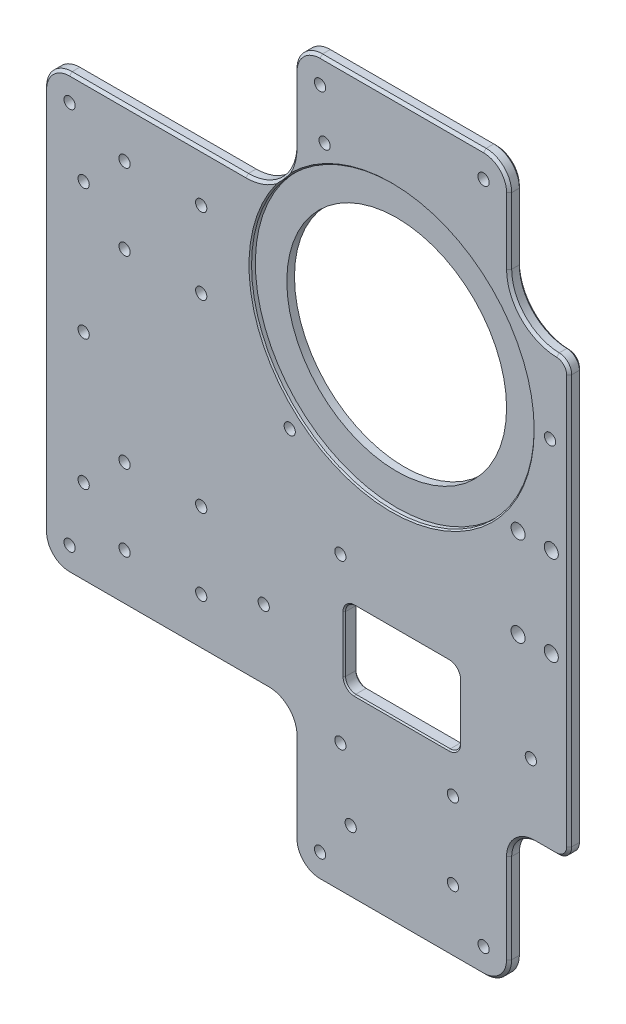
from build123d import *

# Parameters (mm, degrees)
SKETCH_1_R               = 2.2
EXTRUDE_1_DEPTH          = 5
FILLET_1_R               = 10
CUT_EXTRUDE_1_REACH      = 322.455
SKETCH_2_R               = 2.2
CUT_EXTRUDE_2_REACH      = 322.455
SKETCH_3_R               = 43
CUT_EXTRUDE_START        = 88.5
SKETCH_4_R               = 55.3
CUT_EXTRUDE_3_DEPTH      = 2
FILLET_2_R               = 19
CHAMFER_2_SIZE           = 0.5
CUT_EXTRUDE_4_DEPTH      = 5
CUT_EXTRUDE_5_DEPTH      = 5
FILLET_6_R               = 5
CHAMFER_6_SIZE           = 1
HOLE_WIZARD_4_4_4_4_1_D  = 4.4
HOLE_WIZARD_4_4_4_4_2_D  = 4.4
CUT_EXTRUDE_6_DEPTH      = 271.652805956
CUT_EXTRUDE_6_DEPTH_BACK = 271.652805956
CHAMFER_7_SIZE           = 0.5


with BuildPart() as part:
    # 草图1 → 凸台-拉伸1 (new body)
    with BuildSketch(Plane.XY):
        Polygon((-45.175512351, 7), (-45.175512351, -163), (52.824487649, -163), (52.824487649, -218), (136.824487649, -218), (136.824487649, -163), (234.824487649, -163), (234.824487649, 7), (136.824487649, 7), (136.824487649, 62), (52.824487649, 62), (52.824487649, 7), align=None)
        with Locations((-13.675512351, -143.9)):
            Circle(SKETCH_1_R, mode=Mode.SUBTRACT)
        with Locations((-13.675512351, -114.1)):
            Circle(SKETCH_1_R, mode=Mode.SUBTRACT)
        with Locations((16.324487649, -143.9)):
            Circle(SKETCH_1_R, mode=Mode.SUBTRACT)
        with Locations((16.324487649, -114.1)):
            Circle(SKETCH_1_R, mode=Mode.SUBTRACT)
        with Locations((173.324487649, -143.9)):
            Circle(SKETCH_1_R, mode=Mode.SUBTRACT)
        with Locations((173.324487649, -114.1)):
            Circle(SKETCH_1_R, mode=Mode.SUBTRACT)
        with Locations((203.324487649, -143.9)):
            Circle(SKETCH_1_R, mode=Mode.SUBTRACT)
        with Locations((203.324487649, -114.1)):
            Circle(SKETCH_1_R, mode=Mode.SUBTRACT)
        with Locations((-13.675512351, -41.9)):
            Circle(SKETCH_1_R, mode=Mode.SUBTRACT)
        with Locations((-13.675512351, -12.1)):
            Circle(SKETCH_1_R, mode=Mode.SUBTRACT)
        with Locations((16.324487649, -41.9)):
            Circle(SKETCH_1_R, mode=Mode.SUBTRACT)
        with Locations((16.324487649, -12.1)):
            Circle(SKETCH_1_R, mode=Mode.SUBTRACT)
        with Locations((173.324487649, -41.9)):
            Circle(SKETCH_1_R, mode=Mode.SUBTRACT)
        with Locations((173.324487649, -12.1)):
            Circle(SKETCH_1_R, mode=Mode.SUBTRACT)
        with Locations((203.324487649, -41.9)):
            Circle(SKETCH_1_R, mode=Mode.SUBTRACT)
        with Locations((203.324487649, -12.1)):
            Circle(SKETCH_1_R, mode=Mode.SUBTRACT)
    extrude(amount=EXTRUDE_1_DEPTH)

    # 圆角1
    fillet_1_edges = [part.edges().sort_by_distance(p)[0] for p in [
        (234.824487649, 7, 2.5),
        (234.824487649, -163, 2.5),
        (136.824487649, -163, 2.5),
        (136.824487649, -218, 2.5),
        (52.824487649, -218, 2.5),
        (52.824487649, -163, 2.5),
        (-45.175512351, -163, 2.5),
        (-45.175512351, 7, 2.5),
        (52.824487649, 62, 2.5),
        (136.824487649, 62, 2.5),
    ]]
    fillet(fillet_1_edges, radius=FILLET_1_R)

    # 草图2 → 切除-拉伸1 (cut, up to next)
    with BuildSketch(Plane(origin=(0, 0, 0), x_dir=(-1, 0, 0), z_dir=(0, 0, -1)), mode=Mode.PRIVATE) as cut_extrude_1_sk1:
        with Locations(Location((-70.783467987, -103.063390978, 0), (0, 0, 90))):
            Circle(SKETCH_2_R)
    cut_extrude_1_tool1 = extrude(cut_extrude_1_sk1.sketch, amount=-CUT_EXTRUDE_1_REACH, mode=Mode.PRIVATE) & part.part
    # 草图2 → 切除-拉伸1 (cut, up to next)
    with BuildSketch(Plane(origin=(0, 0, 0), x_dir=(-1, 0, 0), z_dir=(0, 0, -1)), mode=Mode.PRIVATE) as cut_extrude_1_sk2:
        with Locations(Location((-40.783467987, -135.063390978, 0), (0, 0, 90))):
            Circle(SKETCH_2_R)
    cut_extrude_1_tool2 = extrude(cut_extrude_1_sk2.sketch, amount=-CUT_EXTRUDE_1_REACH, mode=Mode.PRIVATE) & part.part
    # 草图2 → 切除-拉伸1 (cut, up to next)
    with BuildSketch(Plane(origin=(0, 0, 0), x_dir=(-1, 0, 0), z_dir=(0, 0, -1)), mode=Mode.PRIVATE) as cut_extrude_1_sk3:
        with Locations(Location((-70.783467987, -167.063390978, 0), (0, 0, 90))):
            Circle(SKETCH_2_R)
    cut_extrude_1_tool3 = extrude(cut_extrude_1_sk3.sketch, amount=-CUT_EXTRUDE_1_REACH, mode=Mode.PRIVATE) & part.part
    add(cut_extrude_1_tool1.solids().sort_by_distance((70.783468, -103.063391, 0))[0], mode=Mode.SUBTRACT)
    add(cut_extrude_1_tool2.solids().sort_by_distance((40.783468, -135.063391, 0))[0], mode=Mode.SUBTRACT)
    add(cut_extrude_1_tool3.solids().sort_by_distance((70.783468, -167.063391, 0))[0], mode=Mode.SUBTRACT)

    # 草图3 → 切除-拉伸2 (cut, up to next)
    with BuildSketch(Plane.XY.offset(5), mode=Mode.PRIVATE) as cut_extrude_2_sk1:
        with Locations((90.824487649, -23)):
            Circle(SKETCH_3_R)
    cut_extrude_2_tool1 = extrude(cut_extrude_2_sk1.sketch, amount=-CUT_EXTRUDE_2_REACH, mode=Mode.PRIVATE) & part.part
    add(cut_extrude_2_tool1.solids().sort_by_distance((90.824488, -23, 5))[0], mode=Mode.SUBTRACT)

    # 草图4 → 切除-拉伸3 (cut)
    with BuildSketch(Plane(origin=(94.824487649, -78, -83.5), x_dir=(0, -1, 0), z_dir=(0, 0, 1)).offset(CUT_EXTRUDE_START)):
        with Locations((-55, -4)):
            Circle(SKETCH_4_R)
    extrude(amount=-CUT_EXTRUDE_3_DEPTH, mode=Mode.SUBTRACT)

    # 圆角2
    # the kernel refuses this fillet: 19 mm, written as the material it adds along each edge
    with BuildSketch(Plane(origin=(52.824487649, 7, 0), x_dir=(-1, 0, 0), z_dir=(0, 0, 1))) as fillet_2_piece_1_section:
        with BuildLine():
            CenterArc((FILLET_2_R, -FILLET_2_R), FILLET_2_R, 90, 90)
            Line((0, -FILLET_2_R), (0, 0))
            Line((0, 0), (FILLET_2_R, 0))
        make_face()
    fillet_2_piece_1 = extrude(amount=3, mode=Mode.PRIVATE)
    fillet_2_piece_1 = fillet_2_piece_1 - Plane(origin=(90.824487649, -23, 0), x_dir=(0, -1, 0), z_dir=(0, 0, 1)) * Cylinder(55.3, 82, mode=Mode.PRIVATE)
    add(fillet_2_piece_1)
    with BuildSketch(Plane(origin=(52.824487649, 7, 0), x_dir=(-1, 0, 0), z_dir=(0, 0, 1))) as fillet_2_piece_2_section:
        with BuildLine():
            CenterArc((FILLET_2_R, -FILLET_2_R), FILLET_2_R, 90, 90)
            Line((0, -FILLET_2_R), (0, 0))
            Line((0, 0), (FILLET_2_R, 0))
        make_face()
    fillet_2_piece_2 = extrude(amount=50.5, mode=Mode.PRIVATE)
    fillet_2_piece_2 = split(fillet_2_piece_2, bisect_by=Plane(origin=(52.824487649, 7, 5), z_dir=(0, 0, -1)), keep=Keep.TOP, mode=Mode.PRIVATE)
    fillet_2_piece_2 = fillet_2_piece_2 - Plane(origin=(90.824487649, -23, 0), x_dir=(0, -1, 0), z_dir=(0, 0, 1)) * Cylinder(55.3, 177, mode=Mode.PRIVATE)
    fillet_2_piece_2 = split(fillet_2_piece_2, bisect_by=Plane(origin=(52.824487649, 7, 3), z_dir=(0, 0, 1)), keep=Keep.TOP, mode=Mode.PRIVATE)
    add(fillet_2_piece_2)
    with BuildSketch(Plane(origin=(52.824487649, 7, 0), x_dir=(-1, 0, 0), z_dir=(0, 0, 1))) as fillet_2_piece_3_section:
        with BuildLine():
            CenterArc((FILLET_2_R, -FILLET_2_R), FILLET_2_R, 90, 90)
            Line((0, -FILLET_2_R), (0, 0))
            Line((0, 0), (FILLET_2_R, 0))
        make_face()
    fillet_2_piece_3 = extrude(amount=3, mode=Mode.PRIVATE)
    fillet_2_piece_3 = fillet_2_piece_3 & Plane(origin=(90.824487649, -23, 0), x_dir=(0, -1, 0), z_dir=(0, 0, 1)) * Cylinder(55.3, 82, mode=Mode.PRIVATE)
    add(fillet_2_piece_3)
    with BuildSketch(Plane(origin=(136.824487649, 7, 0), x_dir=(1, 0, 0), z_dir=(0, 0, 1))) as fillet_2_piece_4_section:
        with BuildLine():
            CenterArc((FILLET_2_R, FILLET_2_R), FILLET_2_R, 180, 90)
            Line((0, FILLET_2_R), (0, 0))
            Line((0, 0), (FILLET_2_R, 0))
        make_face()
    fillet_2_piece_4 = extrude(amount=3, mode=Mode.PRIVATE)
    fillet_2_piece_4 = fillet_2_piece_4 - Plane(origin=(90.824487649, -23, 0), x_dir=(0, -1, 0), z_dir=(0, 0, 1)) * Cylinder(55.3, 82, mode=Mode.PRIVATE)
    add(fillet_2_piece_4)
    with BuildSketch(Plane(origin=(136.824487649, 7, 0), x_dir=(1, 0, 0), z_dir=(0, 0, 1))) as fillet_2_piece_5_section:
        with BuildLine():
            CenterArc((FILLET_2_R, FILLET_2_R), FILLET_2_R, 180, 90)
            Line((0, FILLET_2_R), (0, 0))
            Line((0, 0), (FILLET_2_R, 0))
        make_face()
    fillet_2_piece_5 = extrude(amount=50.5, mode=Mode.PRIVATE)
    fillet_2_piece_5 = split(fillet_2_piece_5, bisect_by=Plane(origin=(136.824487649, 7, 3), z_dir=(0, 0, 1)), keep=Keep.TOP, mode=Mode.PRIVATE)
    fillet_2_piece_5 = fillet_2_piece_5 - Plane(origin=(90.824487649, -23, 0), x_dir=(0, -1, 0), z_dir=(0, 0, 1)) * Cylinder(55.3, 177, mode=Mode.PRIVATE)
    fillet_2_piece_5 = split(fillet_2_piece_5, bisect_by=Plane(origin=(136.824487649, 7, 5), z_dir=(0, 0, -1)), keep=Keep.TOP, mode=Mode.PRIVATE)
    add(fillet_2_piece_5)
    with BuildSketch(Plane(origin=(136.824487649, 7, 0), x_dir=(1, 0, 0), z_dir=(0, 0, 1))) as fillet_2_piece_6_section:
        with BuildLine():
            CenterArc((FILLET_2_R, FILLET_2_R), FILLET_2_R, 180, 90)
            Line((0, FILLET_2_R), (0, 0))
            Line((0, 0), (FILLET_2_R, 0))
        make_face()
    fillet_2_piece_6 = extrude(amount=3, mode=Mode.PRIVATE)
    fillet_2_piece_6 = fillet_2_piece_6 & Plane(origin=(90.824487649, -23, 0), x_dir=(0, -1, 0), z_dir=(0, 0, 1)) * Cylinder(55.3, 82, mode=Mode.PRIVATE)
    add(fillet_2_piece_6)

    # 倒角2
    chamfer_2_edges = [part.edges().sort_by_distance(p)[0] for p in [
        (44.369240368, -53, 5),
    ]]
    chamfer(chamfer_2_edges, length=CHAMFER_2_SIZE)

    # 草图5 → 切除-拉伸4 (cut)
    with BuildSketch(Plane(origin=(0, 0, 0), x_dir=(-1, 0, 0), z_dir=(0, 0, -1))):
        Polygon((-160.324487649, 144.237550132), (-160.324487649, -369.254331215), (-426.848254203, -31.852808325), align=None)
    extrude(amount=-CUT_EXTRUDE_4_DEPTH, mode=Mode.SUBTRACT)

    # 草图6 → 切除-拉伸5 (cut)
    with BuildSketch(Plane(origin=(0, 0, 0), x_dir=(-1, 0, 0), z_dir=(0, 0, -1))):
        with BuildLine():
            ThreePointArc((-150.574487649, -95.5), (-153.324487649, -92.75), (-156.074487649, -95.5))
            ThreePointArc((-156.074487649, -95.5), (-153.324487649, -98.25), (-150.574487649, -95.5))
        make_face()
        with BuildLine():
            ThreePointArc((-137.574487649, -95.5), (-140.324487649, -92.75), (-143.074487649, -95.5))
            ThreePointArc((-143.074487649, -95.5), (-140.324487649, -98.25), (-137.574487649, -95.5))
        make_face()
        with BuildLine():
            ThreePointArc((-150.574487649, -60.5), (-153.324487649, -57.75), (-156.074487649, -60.5))
            ThreePointArc((-156.074487649, -60.5), (-153.324487649, -63.25), (-150.574487649, -60.5))
        make_face()
        with BuildLine():
            ThreePointArc((-137.574487649, -60.5), (-140.324487649, -57.75), (-143.074487649, -60.5))
            ThreePointArc((-143.074487649, -60.5), (-140.324487649, -63.25), (-137.574487649, -60.5))
        make_face()
    extrude(amount=-CUT_EXTRUDE_5_DEPTH, mode=Mode.SUBTRACT)

    # 圆角6
    fillet_6_edges = [part.edges().sort_by_distance(p)[0] for p in [
        (160.324487649, 7, 2.5),
        (160.324487649, -163, 2.5),
    ]]
    fillet(fillet_6_edges, radius=FILLET_6_R)

    # 倒角6
    # the kernel refuses this chamfer: 1 mm, written as the material it takes off along each edge
    with BuildSketch(Plane(origin=(52.824487649, 52, 5), x_dir=(1, 0, 0), z_dir=(0, -1, 0)), Plane(origin=(136.824487649, 26, 0), x_dir=(0, 0, 1), z_dir=(0, 1, 0)), Plane(origin=(52.824487649, 52, 0), x_dir=(0, 0, 1), z_dir=(0, -1, 0)), Plane(origin=(136.824487649, 26, 5), x_dir=(-1, 0, 0), z_dir=(0, 1, 0))) as chamfer_6_piece_1:
        Polygon((CHAMFER_6_SIZE, 0), (0, -CHAMFER_6_SIZE), (0, 0), align=None)
    extrude(amount=26, mode=Mode.SUBTRACT)
    with BuildSketch(Plane(origin=(33.824487649, 7, 5), x_dir=(0, -1, 0), z_dir=(-1, 0, 0)), Plane(origin=(33.824487649, 7, 0), x_dir=(0, 0, 1), z_dir=(-1, 0, 0))) as chamfer_6_piece_2:
        Polygon((CHAMFER_6_SIZE, 0), (0, -CHAMFER_6_SIZE), (0, 0), align=None)
    extrude(amount=69, mode=Mode.SUBTRACT)
    with BuildSketch(Plane(origin=(-45.175512351, -3, 5), x_dir=(1, 0, 0), z_dir=(0, -1, 0)), Plane(origin=(-45.175512351, -3, 0), x_dir=(0, 0, 1), z_dir=(0, -1, 0))) as chamfer_6_piece_3:
        Polygon((CHAMFER_6_SIZE, 0), (0, -CHAMFER_6_SIZE), (0, 0), align=None)
    extrude(amount=150, mode=Mode.SUBTRACT)
    with BuildSketch(Plane(origin=(-35.175512351, -163, 5), x_dir=(0, 1, 0), z_dir=(1, 0, 0)), Plane(origin=(-35.175512351, -163, 0), x_dir=(0, 0, 1), z_dir=(1, 0, 0))) as chamfer_6_piece_4:
        Polygon((CHAMFER_6_SIZE, 0), (0, -CHAMFER_6_SIZE), (0, 0), align=None)
    extrude(amount=78, mode=Mode.SUBTRACT)
    with BuildSketch(Plane(origin=(52.824487649, -173, 5), x_dir=(1, 0, 0), z_dir=(0, -1, 0)), Plane(origin=(136.824487649, -208, 5), x_dir=(-1, 0, 0), z_dir=(0, 1, 0)), Plane(origin=(136.824487649, -208, 0), x_dir=(0, 0, 1), z_dir=(0, 1, 0)), Plane(origin=(52.824487649, -173, 0), x_dir=(0, 0, 1), z_dir=(0, -1, 0))) as chamfer_6_piece_5:
        Polygon((CHAMFER_6_SIZE, 0), (0, -CHAMFER_6_SIZE), (0, 0), align=None)
    extrude(amount=35, mode=Mode.SUBTRACT)
    with BuildSketch(Plane(origin=(62.824487649, -218, 5), x_dir=(0, 1, 0), z_dir=(1, 0, 0)), Plane(origin=(62.824487649, -218, 0), x_dir=(0, 0, 1), z_dir=(1, 0, 0)), Plane(origin=(126.824487649, 62, 0), x_dir=(0, 0, 1), z_dir=(-1, 0, 0)), Plane(origin=(126.824487649, 62, 5), x_dir=(0, -1, 0), z_dir=(-1, 0, 0))) as chamfer_6_piece_6:
        Polygon((CHAMFER_6_SIZE, 0), (0, -CHAMFER_6_SIZE), (0, 0), align=None)
    extrude(amount=64, mode=Mode.SUBTRACT)
    with BuildSketch(Plane(origin=(-35.175512351, -153, 5), x_dir=(-1, 0, 0), z_dir=(0, 1, 0))) as chamfer_6_piece_7:
        Polygon((10 - CHAMFER_6_SIZE, 0), (10, -CHAMFER_6_SIZE), (10, 0), align=None)
    revolve(axis=Axis((-35.175512351, -153, 5), (0, 0, 1)), revolution_arc=90, mode=Mode.SUBTRACT)
    with BuildSketch(Plane(origin=(62.824487649, -208, 5), x_dir=(-1, 0, 0), z_dir=(0, 1, 0))) as chamfer_6_piece_8:
        Polygon((10 - CHAMFER_6_SIZE, 0), (10, -CHAMFER_6_SIZE), (10, 0), align=None)
    revolve(axis=Axis((62.824487649, -208, 5), (0, 0, 1)), revolution_arc=90, mode=Mode.SUBTRACT)
    with BuildSketch(Plane(origin=(126.824487649, -208, 5), x_dir=(0, -1, 0), z_dir=(-1, 0, 0))) as chamfer_6_piece_9:
        Polygon((10 - CHAMFER_6_SIZE, 0), (10, -CHAMFER_6_SIZE), (10, 0), align=None)
    revolve(axis=Axis((126.824487649, -208, 5), (0, 0, 1)), revolution_arc=90, mode=Mode.SUBTRACT)
    with BuildSketch(Plane(origin=(126.824487649, 52, 5), x_dir=(1, 0, 0), z_dir=(0, -1, 0))) as chamfer_6_piece_10:
        Polygon((10 - CHAMFER_6_SIZE, 0), (10, -CHAMFER_6_SIZE), (10, 0), align=None)
    revolve(axis=Axis((126.824487649, 52, 5), (0, 0, 1)), revolution_arc=90, mode=Mode.SUBTRACT)
    with BuildSketch(Plane(origin=(62.824487649, 52, 5), x_dir=(0, 1, 0), z_dir=(1, 0, 0))) as chamfer_6_piece_11:
        Polygon((10 - CHAMFER_6_SIZE, 0), (10, -CHAMFER_6_SIZE), (10, 0), align=None)
    revolve(axis=Axis((62.824487649, 52, 5), (0, 0, 1)), revolution_arc=90, mode=Mode.SUBTRACT)
    with BuildSketch(Plane(origin=(-35.175512351, -3, 5), x_dir=(0, 1, 0), z_dir=(1, 0, 0))) as chamfer_6_piece_12:
        Polygon((10 - CHAMFER_6_SIZE, 0), (10, -CHAMFER_6_SIZE), (10, 0), align=None)
    revolve(axis=Axis((-35.175512351, -3, 5), (0, 0, 1)), revolution_arc=90, mode=Mode.SUBTRACT)
    with BuildSketch(Plane(origin=(146.824487649, -173, 0), x_dir=(-1, 0, 0), z_dir=(0, -1, 0))) as chamfer_6_piece_13:
        Polygon((10, -CHAMFER_6_SIZE), (10 + CHAMFER_6_SIZE, 0), (10, 0), align=None)
    revolve(axis=Axis((146.824487649, -173, 0), (0, 0, -1)), revolution_arc=90, mode=Mode.SUBTRACT)
    with BuildSketch(Plane(origin=(146.824487649, -173, 5), x_dir=(-1, 0, 0), z_dir=(0, -1, 0))) as chamfer_6_piece_14:
        Polygon((10 + CHAMFER_6_SIZE, 0), (10, CHAMFER_6_SIZE), (10, 0), align=None)
    revolve(axis=Axis((146.824487649, -173, 5), (0, 0, -1)), revolution_arc=90, mode=Mode.SUBTRACT)
    with BuildSketch(Plane(origin=(42.824487649, -173, 0), x_dir=(0, 1, 0), z_dir=(-1, 0, 0))) as chamfer_6_piece_15:
        Polygon((10, -CHAMFER_6_SIZE), (10 + CHAMFER_6_SIZE, 0), (10, 0), align=None)
    revolve(axis=Axis((42.824487649, -173, 0), (0, 0, -1)), revolution_arc=90, mode=Mode.SUBTRACT)
    with BuildSketch(Plane(origin=(42.824487649, -173, 5), x_dir=(0, 1, 0), z_dir=(-1, 0, 0))) as chamfer_6_piece_16:
        Polygon((10 + CHAMFER_6_SIZE, 0), (10, CHAMFER_6_SIZE), (10, 0), align=None)
    revolve(axis=Axis((42.824487649, -173, 5), (0, 0, -1)), revolution_arc=90, mode=Mode.SUBTRACT)
    with BuildSketch(Plane(origin=(33.824487649, 26, 0), x_dir=(0, -1, 0), z_dir=(-1, 0, 0))) as chamfer_6_piece_17:
        Polygon((19, CHAMFER_6_SIZE), (19 + CHAMFER_6_SIZE, 0), (19, 0), align=None)
    revolve(axis=Axis((33.824487649, 26, 0), (0, 0, 1)), revolution_arc=90, mode=Mode.SUBTRACT)
    with BuildSketch(Plane(origin=(33.824487649, 26, 5), x_dir=(1, 0, 0), z_dir=(0, 1, 0))) as chamfer_6_piece_18:
        Polygon((19 + CHAMFER_6_SIZE, 0), (19, CHAMFER_6_SIZE), (19, 0), align=None)
    revolve(axis=Axis((33.824487649, 26, 5), (0, 0, -1)), revolution_arc=90, mode=Mode.SUBTRACT)
    with BuildSketch(Plane(origin=(155.824487649, 26, 0), x_dir=(-1, 0, 0), z_dir=(0, 1, 0))) as chamfer_6_piece_19:
        Polygon((19, CHAMFER_6_SIZE), (19 + CHAMFER_6_SIZE, 0), (19, 0), align=None)
    revolve(axis=Axis((155.824487649, 26, 0), (0, 0, 1)), revolution_arc=88.806251563, mode=Mode.SUBTRACT)
    with BuildSketch(Plane(origin=(155.824487649, 26, 5), x_dir=(-0.020833333333327847, -0.9997829625584856, 0), z_dir=(0.9997829625584856, -0.020833333333327847, 0))) as chamfer_6_piece_20:
        Polygon((19 + CHAMFER_6_SIZE, 0), (19, CHAMFER_6_SIZE), (19, 0), align=None)
    revolve(axis=Axis((155.824487649, 26, 5), (0, 0, -1)), revolution_arc=88.806251563, mode=Mode.SUBTRACT)
    with BuildSketch(Plane(origin=(160.324487649, 2.005208899, 0), x_dir=(0, 0, 1), z_dir=(0, -1, 0)), Plane(origin=(160.324487649, 2.005208899, 5), x_dir=(-1, 0, 0), z_dir=(0, -1, 0))) as chamfer_6_piece_21:
        Polygon((CHAMFER_6_SIZE, 0), (0, CHAMFER_6_SIZE), (0, 0), align=None)
    extrude(amount=160.005208899, mode=Mode.SUBTRACT)
    with BuildSketch(Plane(origin=(146.824487649, -163, 0), x_dir=(0, 0, 1), z_dir=(1, 0, 0)), Plane(origin=(146.824487649, -163, 5), x_dir=(0, 1, 0), z_dir=(1, 0, 0))) as chamfer_6_piece_22:
        Polygon((CHAMFER_6_SIZE, 0), (0, -CHAMFER_6_SIZE), (0, 0), align=None)
    extrude(amount=8.5, mode=Mode.SUBTRACT)
    with BuildSketch(Plane(origin=(155.324487649, -158, 0), x_dir=(1, 0, 0), z_dir=(0, 1, 0))) as chamfer_6_piece_23:
        Polygon((5, -CHAMFER_6_SIZE), (5 - CHAMFER_6_SIZE, 0), (5, 0), align=None)
    revolve(axis=Axis((155.324487649, -158, 0), (0, 0, -1)), revolution_arc=90, mode=Mode.SUBTRACT)
    with BuildSketch(Plane(origin=(155.324487658, 2.005208938, 0), x_dir=(0.020833331644021527, 0.9997829625936873, 0), z_dir=(-0.9997829625936873, 0.020833331644021527, 0))) as chamfer_6_piece_24:
        Polygon((4.99999996 + CHAMFER_6_SIZE * 5.44080602793e-09, -CHAMFER_6_SIZE), (4.99999996 - CHAMFER_6_SIZE, 0), (4.99999996, 0), align=None)
    revolve(axis=Axis((155.324487658, 2.005208938, 0), (0, 0, -1)), revolution_arc=88.806252113, mode=Mode.SUBTRACT)
    with BuildSketch(Plane(origin=(155.324487649, -158, 5), x_dir=(1, 0, 0), z_dir=(0, 1, 0))) as chamfer_6_piece_25:
        Polygon((5 - CHAMFER_6_SIZE, 0), (5, CHAMFER_6_SIZE), (5, 0), align=None)
    revolve(axis=Axis((155.324487649, -158, 5), (0, 0, -1)), revolution_arc=90, mode=Mode.SUBTRACT)
    with BuildSketch(Plane(origin=(155.324487658, 2.005208938, 5), x_dir=(0.02083333164402158, 0.9997829625936873, 0), z_dir=(-0.9997829625936873, 0.02083333164402158, 0))) as chamfer_6_piece_26:
        Polygon((4.99999996 - CHAMFER_6_SIZE, 0), (4.99999996 + CHAMFER_6_SIZE * 5.44083711418e-09, CHAMFER_6_SIZE), (4.99999996, 0), align=None)
    revolve(axis=Axis((155.324487658, 2.005208938, 5), (0, 0, -1)), revolution_arc=88.806252113, mode=Mode.SUBTRACT)
    with BuildSketch(Plane(origin=(-35.175512351, -153, 0), x_dir=(-1, 0, 0), z_dir=(0, 1, 0))) as chamfer_6_piece_27:
        Polygon((10, CHAMFER_6_SIZE), (10 - CHAMFER_6_SIZE, 0), (10, 0), align=None)
    revolve(axis=Axis((-35.175512351, -153, 0), (0, 0, 1)), revolution_arc=90, mode=Mode.SUBTRACT)
    with BuildSketch(Plane(origin=(62.824487649, -208, 0), x_dir=(-1, 0, 0), z_dir=(0, 1, 0))) as chamfer_6_piece_28:
        Polygon((10, CHAMFER_6_SIZE), (10 - CHAMFER_6_SIZE, 0), (10, 0), align=None)
    revolve(axis=Axis((62.824487649, -208, 0), (0, 0, 1)), revolution_arc=90, mode=Mode.SUBTRACT)
    with BuildSketch(Plane(origin=(126.824487649, -208, 0), x_dir=(0, -1, 0), z_dir=(-1, 0, 0))) as chamfer_6_piece_29:
        Polygon((10, CHAMFER_6_SIZE), (10 - CHAMFER_6_SIZE, 0), (10, 0), align=None)
    revolve(axis=Axis((126.824487649, -208, 0), (0, 0, 1)), revolution_arc=90, mode=Mode.SUBTRACT)
    with BuildSketch(Plane(origin=(126.824487649, 52, 0), x_dir=(1, 0, 0), z_dir=(0, -1, 0))) as chamfer_6_piece_30:
        Polygon((10, CHAMFER_6_SIZE), (10 - CHAMFER_6_SIZE, 0), (10, 0), align=None)
    revolve(axis=Axis((126.824487649, 52, 0), (0, 0, 1)), revolution_arc=90, mode=Mode.SUBTRACT)
    with BuildSketch(Plane(origin=(62.824487649, 52, 0), x_dir=(0, 1, 0), z_dir=(1, 0, 0))) as chamfer_6_piece_31:
        Polygon((10, CHAMFER_6_SIZE), (10 - CHAMFER_6_SIZE, 0), (10, 0), align=None)
    revolve(axis=Axis((62.824487649, 52, 0), (0, 0, 1)), revolution_arc=90, mode=Mode.SUBTRACT)
    with BuildSketch(Plane(origin=(-35.175512351, -3, 0), x_dir=(0, 1, 0), z_dir=(1, 0, 0))) as chamfer_6_piece_32:
        Polygon((10, CHAMFER_6_SIZE), (10 - CHAMFER_6_SIZE, 0), (10, 0), align=None)
    revolve(axis=Axis((-35.175512351, -3, 0), (0, 0, 1)), revolution_arc=90, mode=Mode.SUBTRACT)

    # Ø4.4 (4.4) 直径孔1 (through all)
    with Locations(Plane(origin=(0, 0, 0), x_dir=(-1, 0, 0), z_dir=(0, 0, -1))):
        with Locations((29.675512351, -129), (35.175512351, -153), (-62.824487649, -208), (-126.824487649, -208), (-145.324487649, -135.063390978), (-152.824487649, -23), (-50.971655849, -70.494755473), (-64.622155421, 33.191082796), (-126.824487649, 52), (-62.824487649, 52), (35.175512351, -3), (29.675512351, -27), (29.675512351, -78)):
            Hole(HOLE_WIZARD_4_4_4_4_1_D / 2)

    # Ø4.4 (4.4) 直径孔2 (through all)
    with Locations(Plane.XY.offset(5)):
        with Locations((74.824487649, -193), (114.824487649, -193), (114.824487649, -163)):
            Hole(HOLE_WIZARD_4_4_4_4_2_D / 2)

    # 草图13 → 切除-拉伸6 (cut, two sides: drawn at the far end of the back side and taken through both)
    with BuildSketch(Plane.XY.offset(5).offset(-CUT_EXTRUDE_6_DEPTH_BACK)):
        with BuildLine():
            Line((113.324487649, -118), (76.324487649, -118))
            ThreePointArc((76.324487649, -118), (73.496060524, -119.171572875), (72.324487649, -122))
            Line((72.324487649, -122), (72.324487649, -144))
            ThreePointArc((72.324487649, -144), (73.496060524, -146.828427125), (76.324487649, -148))
            Line((76.324487649, -148), (113.324487649, -148))
            ThreePointArc((113.324487649, -148), (116.152914774, -146.828427125), (117.324487649, -144))
            Line((117.324487649, -144), (117.324487649, -122))
            ThreePointArc((117.324487649, -122), (116.152914774, -119.171572875), (113.324487649, -118))
        make_face()
    extrude(amount=CUT_EXTRUDE_6_DEPTH + CUT_EXTRUDE_6_DEPTH_BACK, mode=Mode.SUBTRACT)

    # 倒角7
    chamfer_7_edges = [part.edges().sort_by_distance(p)[0] for p in [
        (72.324487649, -133, 5),
        (73.496060524, -146.828427125, 5),
        (94.824487649, -148, 5),
        (116.152914774, -146.828427125, 5),
        (117.324487649, -133, 5),
        (116.152914774, -119.171572875, 5),
        (94.824487649, -118, 5),
        (73.496060524, -119.171572875, 5),
        (73.496060524, -119.171572875, 0),
        (94.824487649, -118, 0),
        (116.152914774, -119.171572875, 0),
        (117.324487649, -133, 0),
        (116.152914774, -146.828427125, 0),
        (94.824487649, -148, 0),
        (73.496060524, -146.828427125, 0),
        (72.324487649, -133, 0),
    ]]
    chamfer(chamfer_7_edges, length=CHAMFER_7_SIZE)


solid = part.part
